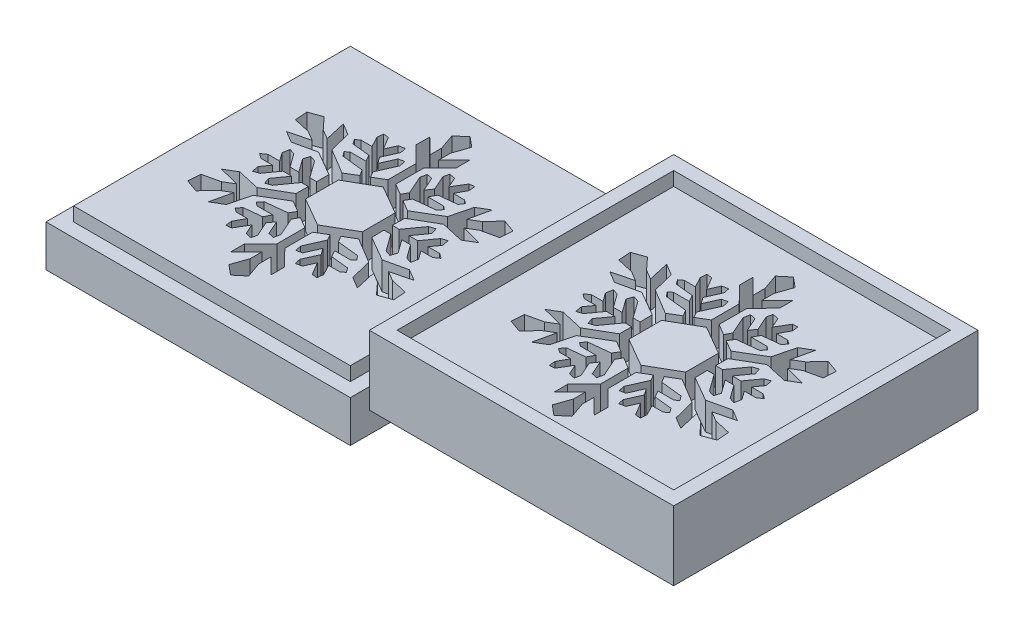
from build123d import *

# Parameters (mm, degrees)
CROQUIS1_W                                   = 110
CROQUIS1_H                                   = 110
SALIENTE_EXTRUIR1_DEPTH                      = 20
CORTAR_EXTRUIR1_DEPTH                        = 10
MATRIZ_START                                 = 12.5
MATRIZ_PARA_COPO_DE_NIEVE_INST_OUTLINE_W     = 110
MATRIZ_PARA_COPO_DE_NIEVE_INST_OUTLINE_H     = 110
MATRIZ_PARA_COPO_DE_NIEVE_INST_DEPTH         = 20
MATRIZ_PARA_COPO_DE_NIEVE_INST_2_DEPTH       = 10
MATRIZ_START_2                               = 32.5
MATRIZ_PARA_COPO_DE_NIEVE_INST_3_OUTLINE_W   = 110
MATRIZ_PARA_COPO_DE_NIEVE_INST_3_OUTLINE_H   = 110
MATRIZ_PARA_COPO_DE_NIEVE_INST_3_OUTLINE_W_2 = 100
MATRIZ_PARA_COPO_DE_NIEVE_INST_3_OUTLINE_H_2 = 100
MATRIZ_PARA_COPO_DE_NIEVE_INST_3_DEPTH       = 5
CROQUIS2_W                                   = 110
CROQUIS2_H                                   = 110
CROQUIS2_W_2                                 = 100
CROQUIS2_H_2                                 = 100
CORTAR_EXTRUIR2_DEPTH                        = 5


# Read off the part's stored shape, not the designer's step: matriz para copo de nieve inst
with BuildPart() as part:
    # Croquis1 → Saliente-Extruir1 (new body)
    with BuildSketch(Plane(origin=(0, 0, 0), x_dir=(1, 0, 0), z_dir=(0, 1, 0))):
        Rectangle(CROQUIS1_W, CROQUIS1_H)
    extrude(amount=SALIENTE_EXTRUIR1_DEPTH)

    # Croquis3 → Cortar-Extruir1 (cut)
    with BuildSketch(Plane(origin=(0, 20, 0), x_dir=(1, 0, 0), z_dir=(0, 1, 0))):
        Polygon((1.401750865, -15.024505482), (1.401750865, -25.082026445), (7.24046247, -31.053498659), (7.24046247, -35.944123141), (1.601246458, -30.344502802), (1.601246458, -34.62741655), (3.576654108, -40.299383405), (0, -43.308998471), (-3.576654108, -40.299383405), (-1.601246458, -34.62741655), (-1.601246458, -30.344502802), (-7.24046247, -35.944123141), (-7.24046247, -31.053498659), (-1.401750865, -25.082026445), (-1.401750865, -15.024505482), (-5.366397426, -12.668526031), (-6.553491469, -14.828021821), (-3.591131353, -21.513153795), (-4.043357191, -23.757533882), (-6.088103363, -23.345532788), (-8.342582526, -18.257869523), (-9.950365645, -20.524956593), (-7.588789114, -25.854305545), (-8.008622187, -27.937921538), (-10.181938561, -27.500014507), (-11.840331452, -23.757533882), (-14.557396536, -28.329816013), (-16.453298086, -28.525494001), (-16.685581739, -26.274924382), (-14.675689124, -22.536524118), (-18.691859369, -22.536524118), (-20.099896599, -21.537965872), (-18.945472608, -19.910147), (-12.480590093, -19.217261965), (-11.178475974, -16.848528018), (-16.886571, -16.848528018), (-18.152803347, -15.857491773), (-16.886571, -14.239645438), (-9.100363099, -13.405145055), (-7.802403677, -11.220936547), (-11.840331452, -8.821409952), (-20.887971279, -14.239645438), (-22.856293838, -21.955271204), (-26.95258016, -24.408357792), (-25.240992324, -16.848528018), (-28.748223024, -18.948854976), (-32.6411281, -23.181814498), (-37.221263287, -21.537965872), (-36.924320104, -17.081609197), (-30.926257151, -15.712777024), (-27.462068783, -13.638226234), (-34.810379623, -11.763608874), (-30.680733119, -9.290544333), (-22.620463637, -11.115434525), (-13.708215403, -5.959407612), (-13.652264332, -1.511972751), (-16.150867319, -1.511972751), (-20.556839856, -7.642319112), (-22.639157972, -8.340866636), (-23.381693859, -6.127422488), (-19.896981445, -1.278891572), (-23.050573262, -1.278891572), (-26.535285676, -6.127422488), (-28.571013719, -6.810340614), (-29.01659951, -4.344064752), (-26.813613241, -1.278891572), (-31.025246179, -1.278891572), (-32.80465997, 0), (-31.025246179, 1.278891572), (-26.813613241, 1.278891572), (-29.01659951, 4.344064752), (-28.571013719, 6.810340614), (-26.535285676, 6.127422488), (-23.050573262, 1.278891572), (-19.896981445, 1.278891572), (-23.381693859, 6.127422488), (-22.639157972, 8.340866636), (-20.556839856, 7.642319112), (-16.150867319, 1.511972751), (-13.652264332, 1.511972751), (-13.708215403, 5.959407612), (-22.620463637, 11.115434525), (-30.680733119, 9.290544333), (-34.810379623, 11.763608874), (-27.462068783, 13.638226234), (-30.926257151, 15.712777024), (-36.924320104, 17.081609197), (-37.221263287, 21.537965872), (-32.6411281, 23.181814498), (-28.748223024, 18.948854976), (-25.240992324, 16.848528018), (-26.95258016, 24.408357792), (-22.856293838, 21.955271204), (-20.887971279, 14.239645438), (-11.840331452, 8.821409952), (-7.802403677, 11.220936547), (-9.100363099, 13.405145055), (-16.886571, 14.239645438), (-18.152803347, 15.857491773), (-16.886571, 16.848528018), (-11.178475974, 16.848528018), (-12.480590093, 19.217261965), (-18.945472608, 19.910147), (-20.099896599, 21.537965872), (-18.691859369, 22.536524118), (-14.675689124, 22.536524118), (-16.685581739, 26.274924382), (-16.453298086, 28.525494001), (-14.557396536, 28.329816013), (-11.840331452, 23.757533882), (-10.181938561, 27.500014507), (-8.008622187, 27.937921538), (-7.588789114, 25.854305545), (-9.950365645, 20.524956593), (-8.342582526, 18.257869523), (-6.088103363, 23.345532788), (-4.043357191, 23.757533882), (-3.591131353, 21.513153795), (-6.553491469, 14.828021821), (-5.366397426, 12.668526031), (-1.401750865, 15.024505482), (-1.401750865, 25.082026445), (-7.24046247, 31.053498659), (-7.24046247, 35.944123141), (-1.601246458, 30.344502802), (-1.601246458, 34.62741655), (-3.576654108, 40.299383405), (0, 43.308998471), (3.576654108, 40.299383405), (1.601246458, 34.62741655), (1.601246458, 30.344502802), (7.24046247, 35.944123141), (7.24046247, 31.053498659), (1.401750865, 25.082026445), (1.401750865, 15.024505482), (5.366397426, 12.668526031), (6.553491469, 14.828021821), (3.591131353, 21.513153795), (4.043357191, 23.757533882), (6.088103363, 23.345532788), (8.342582526, 18.257869523), (9.950365645, 20.524956593), (7.588789114, 25.854305545), (8.008622187, 27.937921538), (10.181938561, 27.500014507), (11.840331452, 23.757533882), (14.557396536, 28.329816013), (16.453298086, 28.525494001), (16.685581739, 26.274924382), (14.675689124, 22.536524118), (18.691859369, 22.536524118), (20.099896599, 21.537965872), (18.945472608, 19.910147), (12.480590093, 19.217261965), (11.178475974, 16.848528018), (16.886571, 16.848528018), (18.152803347, 15.857491773), (16.886571, 14.239645438), (9.100363099, 13.405145055), (7.802403677, 11.220936547), (11.840331452, 8.821409952), (20.887971279, 14.239645438), (22.856293838, 21.955271204), (26.95258016, 24.408357792), (25.240992324, 16.848528018), (28.748223024, 18.948854976), (32.6411281, 23.181814498), (37.221263287, 21.537965872), (36.924320104, 17.081609197), (30.926257151, 15.712777024), (27.462068783, 13.638226234), (34.810379623, 11.763608874), (30.680733119, 9.290544333), (22.620463637, 11.115434525), (13.708215403, 5.959407612), (13.652264332, 1.511972751), (16.150867319, 1.511972751), (20.556839856, 7.642319112), (22.639157972, 8.340866636), (23.381693859, 6.127422488), (19.896981445, 1.278891572), (23.050573262, 1.278891572), (26.535285676, 6.127422488), (28.571013719, 6.810340614), (29.01659951, 4.344064752), (26.813613241, 1.278891572), (31.025246179, 1.278891572), (32.80465997, 0), (31.025246179, -1.278891572), (26.813613241, -1.278891572), (29.01659951, -4.344064752), (28.571013719, -6.810340614), (26.535285676, -6.127422488), (23.050573262, -1.278891572), (19.896981445, -1.278891572), (23.381693859, -6.127422488), (22.639157972, -8.340866636), (20.556839856, -7.642319112), (16.150867319, -1.511972751), (13.652264332, -1.511972751), (13.708215403, -5.959407612), (22.620463637, -11.115434525), (30.680733119, -9.290544333), (34.810379623, -11.763608874), (27.462068783, -13.638226234), (30.926257151, -15.712777024), (36.924320104, -17.081609197), (37.221263287, -21.537965872), (32.6411281, -23.181814498), (28.748223024, -18.948854976), (25.240992324, -16.848528018), (26.95258016, -24.408357792), (22.856293838, -21.955271204), (20.887971279, -14.239645438), (11.840331452, -8.821409952), (7.802403677, -11.220936547), (9.100363099, -13.405145055), (16.886571, -14.239645438), (18.152803347, -15.857491773), (16.886571, -16.848528018), (11.178475974, -16.848528018), (12.480590093, -19.217261965), (18.945472608, -19.910147), (20.099896599, -21.537965872), (18.691859369, -22.536524118), (14.675689124, -22.536524118), (16.685581739, -26.274924382), (16.453298086, -28.525494001), (14.557396536, -28.329816013), (11.840331452, -23.757533882), (10.181938561, -27.500014507), (8.008622187, -27.937921538), (7.588789114, -25.854305545), (9.950365645, -20.524956593), (8.342582526, -18.257869523), (6.088103363, -23.345532788), (4.043357191, -23.757533882), (3.591131353, -21.513153795), (6.553491469, -14.828021821), (5.366397426, -12.668526031), align=None)
        Polygon((10.26956557, -5.929136446), (10.26956557, 5.929136446), (0, 11.858272893), (-10.26956557, 5.929136446), (-10.26956557, -5.929136446), (0, -11.858272893), align=None, mode=Mode.SUBTRACT)
    extrude(amount=-CORTAR_EXTRUIR1_DEPTH, mode=Mode.SUBTRACT)

    # Croquis2 → Cortar-Extruir2 (cut)
    with BuildSketch(Plane(origin=(0, 20, 0), x_dir=(1, 0, 0), z_dir=(0, 1, 0))):
        Rectangle(CROQUIS2_W, CROQUIS2_H)
        Rectangle(CROQUIS2_W_2, CROQUIS2_H_2, mode=Mode.SUBTRACT)
    extrude(amount=-CORTAR_EXTRUIR2_DEPTH, mode=Mode.SUBTRACT)


with BuildPart() as body_2:
    # matriz para copo de nieve inst outline → matriz para copo de nieve inst (new body)
    # profile 1 of 2: a face of its own
    with BuildSketch(Plane(origin=(0, 0, 0), x_dir=(1, 0, 0), z_dir=(0, 1, 0)).offset(MATRIZ_START)):
        with Locations((114.843651792, 2.026652679)):
            Rectangle(MATRIZ_PARA_COPO_DE_NIEVE_INST_OUTLINE_W, MATRIZ_PARA_COPO_DE_NIEVE_INST_OUTLINE_H)
        Polygon((122.084114261, -33.917470462), (116.44489825, -28.317850124), (116.44489825, -32.600763871), (118.4203059, -38.272730726), (114.843651792, -41.282345792), (111.266997684, -38.272730726), (113.242405333, -32.600763871), (113.242405333, -28.317850124), (107.603189322, -33.917470462), (107.603189322, -29.02684598), (113.441900926, -23.055373767), (113.441900926, -12.997852803), (109.477254366, -10.641873352), (108.290160323, -12.801369143), (111.252520439, -19.486501117), (110.8002946, -21.730881203), (108.755548429, -21.318880109), (106.501069266, -16.231216844), (104.893286146, -18.498303914), (107.254862678, -23.827652867), (106.835029605, -25.911268859), (104.661713231, -25.473361829), (103.00332034, -21.730881203), (100.286255255, -26.303163334), (98.390353705, -26.498841323), (98.158070053, -24.248271703), (100.167962668, -20.50987144), (96.151792423, -20.50987144), (94.743755193, -19.511313193), (95.898179184, -17.883494322), (102.363061699, -17.190609286), (103.665175818, -14.82187534), (97.957080791, -14.82187534), (96.690848444, -13.830839094), (97.957080791, -12.212992759), (105.743288692, -11.378492376), (107.041248115, -9.194283868), (103.00332034, -6.794757274), (93.955680513, -12.212992759), (91.987357953, -19.928618525), (87.891071631, -22.381705113), (89.602659468, -14.82187534), (86.095428768, -16.922202298), (82.202523691, -21.155161819), (77.622388505, -19.511313193), (77.919331687, -15.054956519), (83.917394641, -13.686124345), (87.381583009, -11.611573555), (80.033272168, -9.736956195), (84.162918672, -7.263891655), (92.223188154, -9.088781847), (101.135436388, -3.932754934), (101.19138746, 0.514679928), (98.692784473, 0.514679928), (94.286811935, -5.615666433), (92.20449382, -6.314213957), (91.461957933, -4.10076981), (94.946670347, 0.747761107), (91.793078529, 0.747761107), (88.308366115, -4.10076981), (86.272638073, -4.783687935), (85.827052282, -2.317412074), (88.030038551, 0.747761107), (83.818405612, 0.747761107), (82.038991822, 2.026652679), (83.818405612, 3.30554425), (88.030038551, 3.30554425), (85.827052282, 6.370717431), (86.272638073, 8.836993292), (88.308366115, 8.154075167), (91.793078529, 3.30554425), (94.946670347, 3.30554425), (91.461957933, 8.154075167), (92.20449382, 10.367519315), (94.286811935, 9.668971791), (98.692784473, 3.538625429), (101.19138746, 3.538625429), (101.135436388, 7.986060291), (92.223188154, 13.142087204), (84.162918672, 11.317197012), (80.033272168, 13.790261553), (87.381583009, 15.664878913), (83.917394641, 17.739429702), (77.919331687, 19.108261876), (77.622388505, 23.56461855), (82.202523691, 25.208467177), (86.095428768, 20.975507655), (89.602659468, 18.875180697), (87.891071631, 26.435010471), (91.987357953, 23.981923883), (93.955680513, 16.266298117), (103.00332034, 10.848062631), (107.041248115, 13.247589226), (105.743288692, 15.431797734), (97.957080791, 16.266298117), (96.690848444, 17.884144451), (97.957080791, 18.875180697), (103.665175818, 18.875180697), (102.363061699, 21.243914644), (95.898179184, 21.936799679), (94.743755193, 23.56461855), (96.151792423, 24.563176797), (100.167962668, 24.563176797), (98.158070053, 28.301577061), (98.390353705, 30.55214668), (100.286255255, 30.356468691), (103.00332034, 25.784186561), (104.661713231, 29.526667186), (106.835029605, 29.964574217), (107.254862678, 27.880958224), (104.893286146, 22.551609272), (106.501069266, 20.284522202), (108.755548429, 25.372185466), (110.8002946, 25.784186561), (111.252520439, 23.539806474), (108.290160323, 16.8546745), (109.477254366, 14.69517871), (113.441900926, 17.05115816), (113.441900926, 27.108679124), (107.603189322, 33.080151338), (107.603189322, 37.97077582), (113.242405333, 32.371155481), (113.242405333, 36.654069229), (111.266997684, 42.326036083), (114.843651792, 45.335651149), (118.4203059, 42.326036083), (116.44489825, 36.654069229), (116.44489825, 32.371155481), (122.084114261, 37.97077582), (122.084114261, 33.080151338), (116.245402657, 27.108679124), (116.245402657, 17.05115816), (120.210049217, 14.69517871), (121.39714326, 16.8546745), (118.434783144, 23.539806474), (118.887008983, 25.784186561), (120.931755154, 25.372185466), (123.186234317, 20.284522202), (124.794017437, 22.551609272), (122.432440905, 27.880958224), (122.852273979, 29.964574217), (125.025590352, 29.526667186), (126.683983243, 25.784186561), (129.401048328, 30.356468691), (131.296949878, 30.55214668), (131.52923353, 28.301577061), (129.519340915, 24.563176797), (133.53551116, 24.563176797), (134.94354839, 23.56461855), (133.7891244, 21.936799679), (127.324241884, 21.243914644), (126.022127765, 18.875180697), (131.730222792, 18.875180697), (132.996455139, 17.884144451), (131.730222792, 16.266298117), (123.944014891, 15.431797734), (122.646055468, 13.247589226), (126.683983243, 10.848062631), (135.73162307, 16.266298117), (137.69994563, 23.981923883), (141.796231952, 26.435010471), (140.084644115, 18.875180697), (143.591874815, 20.975507655), (147.484779892, 25.208467177), (152.064915078, 23.56461855), (151.767971896, 19.108261876), (145.769908943, 17.739429702), (142.305720574, 15.664878913), (149.654031415, 13.790261553), (145.524384911, 11.317197012), (137.464115429, 13.142087204), (128.551867195, 7.986060291), (128.495916123, 3.538625429), (130.99451911, 3.538625429), (135.400491648, 9.668971791), (137.482809764, 10.367519315), (138.22534565, 8.154075167), (134.740633236, 3.30554425), (137.894225054, 3.30554425), (141.378937468, 8.154075167), (143.41466551, 8.836993292), (143.860251301, 6.370717431), (141.657265032, 3.30554425), (145.868897971, 3.30554425), (147.648311761, 2.026652679), (145.868897971, 0.747761107), (141.657265032, 0.747761107), (143.860251301, -2.317412074), (143.41466551, -4.783687935), (141.378937468, -4.10076981), (137.894225054, 0.747761107), (134.740633236, 0.747761107), (138.22534565, -4.10076981), (137.482809764, -6.314213957), (135.400491648, -5.615666433), (130.99451911, 0.514679928), (128.495916123, 0.514679928), (128.551867195, -3.932754934), (137.464115429, -9.088781847), (145.524384911, -7.263891655), (149.654031415, -9.736956195), (142.305720574, -11.611573555), (145.769908943, -13.686124345), (151.767971896, -15.054956519), (152.064915078, -19.511313193), (147.484779892, -21.155161819), (143.591874815, -16.922202298), (140.084644115, -14.82187534), (141.796231952, -22.381705113), (137.69994563, -19.928618525), (135.73162307, -12.212992759), (126.683983243, -6.794757274), (122.646055468, -9.194283868), (123.944014891, -11.378492376), (131.730222792, -12.212992759), (132.996455139, -13.830839094), (131.730222792, -14.82187534), (126.022127765, -14.82187534), (127.324241884, -17.190609286), (133.7891244, -17.883494322), (134.94354839, -19.511313193), (133.53551116, -20.50987144), (129.519340915, -20.50987144), (131.52923353, -24.248271703), (131.296949878, -26.498841323), (129.401048328, -26.303163334), (126.683983243, -21.730881203), (125.025590352, -25.473361829), (122.852273979, -25.911268859), (122.432440905, -23.827652867), (124.794017437, -18.498303914), (123.186234317, -16.231216844), (120.931755154, -21.318880109), (118.887008983, -21.730881203), (118.434783144, -19.486501117), (121.39714326, -12.801369143), (120.210049217, -10.641873352), (116.245402657, -12.997852803), (116.245402657, -23.055373767), (122.084114261, -29.02684598), align=None, mode=Mode.SUBTRACT)
    # profile 2 of 2: a face of its own
    with BuildSketch(Plane(origin=(0, 0, 0), x_dir=(1, 0, 0), z_dir=(0, 1, 0)).offset(MATRIZ_START)):
        Polygon((104.574086222, -3.902483768), (114.843651792, -9.831620214), (125.113217362, -3.902483768), (125.113217362, 7.955789125), (114.843651792, 13.884925571), (104.574086222, 7.955789125), align=None)
    extrude(amount=MATRIZ_PARA_COPO_DE_NIEVE_INST_DEPTH)

    # matriz para copo de nieve inst 2 outline → matriz para copo de nieve inst 2 (add)
    with BuildSketch(Plane(origin=(0, 0, 0), x_dir=(1, 0, 0), z_dir=(0, 1, 0)).offset(MATRIZ_START)):
        Polygon((116.245402657, -23.055373767), (116.245402657, -12.997852803), (120.210049217, -10.641873352), (121.39714326, -12.801369143), (118.434783144, -19.486501117), (118.887008983, -21.730881203), (120.931755154, -21.318880109), (123.186234317, -16.231216844), (124.794017437, -18.498303914), (122.432440905, -23.827652867), (122.852273979, -25.911268859), (125.025590352, -25.473361829), (126.683983243, -21.730881203), (129.401048328, -26.303163334), (131.296949878, -26.498841323), (131.52923353, -24.248271703), (129.519340915, -20.50987144), (133.53551116, -20.50987144), (134.94354839, -19.511313193), (133.7891244, -17.883494322), (127.324241884, -17.190609286), (126.022127765, -14.82187534), (131.730222792, -14.82187534), (132.996455139, -13.830839094), (131.730222792, -12.212992759), (123.944014891, -11.378492376), (122.646055468, -9.194283868), (126.683983243, -6.794757274), (135.73162307, -12.212992759), (137.69994563, -19.928618525), (141.796231952, -22.381705113), (140.084644115, -14.82187534), (143.591874815, -16.922202298), (147.484779892, -21.155161819), (152.064915078, -19.511313193), (151.767971896, -15.054956519), (145.769908943, -13.686124345), (142.305720574, -11.611573555), (149.654031415, -9.736956195), (145.524384911, -7.263891655), (137.464115429, -9.088781847), (128.551867195, -3.932754934), (128.495916123, 0.514679928), (130.99451911, 0.514679928), (135.400491648, -5.615666433), (137.482809764, -6.314213957), (138.22534565, -4.10076981), (134.740633236, 0.747761107), (137.894225054, 0.747761107), (141.378937468, -4.10076981), (143.41466551, -4.783687935), (143.860251301, -2.317412074), (141.657265032, 0.747761107), (145.868897971, 0.747761107), (147.648311761, 2.026652679), (145.868897971, 3.30554425), (141.657265032, 3.30554425), (143.860251301, 6.370717431), (143.41466551, 8.836993292), (141.378937468, 8.154075167), (137.894225054, 3.30554425), (134.740633236, 3.30554425), (138.22534565, 8.154075167), (137.482809764, 10.367519315), (135.400491648, 9.668971791), (130.99451911, 3.538625429), (128.495916123, 3.538625429), (128.551867195, 7.986060291), (137.464115429, 13.142087204), (145.524384911, 11.317197012), (149.654031415, 13.790261553), (142.305720574, 15.664878913), (145.769908943, 17.739429702), (151.767971896, 19.108261876), (152.064915078, 23.56461855), (147.484779892, 25.208467177), (143.591874815, 20.975507655), (140.084644115, 18.875180697), (141.796231952, 26.435010471), (137.69994563, 23.981923883), (135.73162307, 16.266298117), (126.683983243, 10.848062631), (122.646055468, 13.247589226), (123.944014891, 15.431797734), (131.730222792, 16.266298117), (132.996455139, 17.884144451), (131.730222792, 18.875180697), (126.022127765, 18.875180697), (127.324241884, 21.243914644), (133.7891244, 21.936799679), (134.94354839, 23.56461855), (133.53551116, 24.563176797), (129.519340915, 24.563176797), (131.52923353, 28.301577061), (131.296949878, 30.55214668), (129.401048328, 30.356468691), (126.683983243, 25.784186561), (125.025590352, 29.526667186), (122.852273979, 29.964574217), (122.432440905, 27.880958224), (124.794017437, 22.551609272), (123.186234317, 20.284522202), (120.931755154, 25.372185466), (118.887008983, 25.784186561), (118.434783144, 23.539806474), (121.39714326, 16.8546745), (120.210049217, 14.69517871), (116.245402657, 17.05115816), (116.245402657, 27.108679124), (122.084114261, 33.080151338), (122.084114261, 37.97077582), (116.44489825, 32.371155481), (116.44489825, 36.654069229), (118.4203059, 42.326036083), (114.843651792, 45.335651149), (111.266997684, 42.326036083), (113.242405333, 36.654069229), (113.242405333, 32.371155481), (107.603189322, 37.97077582), (107.603189322, 33.080151338), (113.441900926, 27.108679124), (113.441900926, 17.05115816), (109.477254366, 14.69517871), (108.290160323, 16.8546745), (111.252520439, 23.539806474), (110.8002946, 25.784186561), (108.755548429, 25.372185466), (106.501069266, 20.284522202), (104.893286146, 22.551609272), (107.254862678, 27.880958224), (106.835029605, 29.964574217), (104.661713231, 29.526667186), (103.00332034, 25.784186561), (100.286255255, 30.356468691), (98.390353705, 30.55214668), (98.158070053, 28.301577061), (100.167962668, 24.563176797), (96.151792423, 24.563176797), (94.743755193, 23.56461855), (95.898179184, 21.936799679), (102.363061699, 21.243914644), (103.665175818, 18.875180697), (97.957080791, 18.875180697), (96.690848444, 17.884144451), (97.957080791, 16.266298117), (105.743288692, 15.431797734), (107.041248115, 13.247589226), (103.00332034, 10.848062631), (93.955680513, 16.266298117), (91.987357953, 23.981923883), (87.891071631, 26.435010471), (89.602659468, 18.875180697), (86.095428768, 20.975507655), (82.202523691, 25.208467177), (77.622388505, 23.56461855), (77.919331687, 19.108261876), (83.917394641, 17.739429702), (87.381583009, 15.664878913), (80.033272168, 13.790261553), (84.162918672, 11.317197012), (92.223188154, 13.142087204), (101.135436388, 7.986060291), (101.19138746, 3.538625429), (98.692784473, 3.538625429), (94.286811935, 9.668971791), (92.20449382, 10.367519315), (91.461957933, 8.154075167), (94.946670347, 3.30554425), (91.793078529, 3.30554425), (88.308366115, 8.154075167), (86.272638073, 8.836993292), (85.827052282, 6.370717431), (88.030038551, 3.30554425), (83.818405612, 3.30554425), (82.038991822, 2.026652679), (83.818405612, 0.747761107), (88.030038551, 0.747761107), (85.827052282, -2.317412074), (86.272638073, -4.783687935), (88.308366115, -4.10076981), (91.793078529, 0.747761107), (94.946670347, 0.747761107), (91.461957933, -4.10076981), (92.20449382, -6.314213957), (94.286811935, -5.615666433), (98.692784473, 0.514679928), (101.19138746, 0.514679928), (101.135436388, -3.932754934), (92.223188154, -9.088781847), (84.162918672, -7.263891655), (80.033272168, -9.736956195), (87.381583009, -11.611573555), (83.917394641, -13.686124345), (77.919331687, -15.054956519), (77.622388505, -19.511313193), (82.202523691, -21.155161819), (86.095428768, -16.922202298), (89.602659468, -14.82187534), (87.891071631, -22.381705113), (91.987357953, -19.928618525), (93.955680513, -12.212992759), (103.00332034, -6.794757274), (107.041248115, -9.194283868), (105.743288692, -11.378492376), (97.957080791, -12.212992759), (96.690848444, -13.830839094), (97.957080791, -14.82187534), (103.665175818, -14.82187534), (102.363061699, -17.190609286), (95.898179184, -17.883494322), (94.743755193, -19.511313193), (96.151792423, -20.50987144), (100.167962668, -20.50987144), (98.158070053, -24.248271703), (98.390353705, -26.498841323), (100.286255255, -26.303163334), (103.00332034, -21.730881203), (104.661713231, -25.473361829), (106.835029605, -25.911268859), (107.254862678, -23.827652867), (104.893286146, -18.498303914), (106.501069266, -16.231216844), (108.755548429, -21.318880109), (110.8002946, -21.730881203), (111.252520439, -19.486501117), (108.290160323, -12.801369143), (109.477254366, -10.641873352), (113.441900926, -12.997852803), (113.441900926, -23.055373767), (107.603189322, -29.02684598), (107.603189322, -33.917470462), (113.242405333, -28.317850124), (113.242405333, -32.600763871), (111.266997684, -38.272730726), (114.843651792, -41.282345792), (118.4203059, -38.272730726), (116.44489825, -32.600763871), (116.44489825, -28.317850124), (122.084114261, -33.917470462), (122.084114261, -29.02684598), align=None)
        Polygon((125.113217362, -3.902483768), (114.843651792, -9.831620214), (104.574086222, -3.902483768), (104.574086222, 7.955789125), (114.843651792, 13.884925571), (125.113217362, 7.955789125), align=None, mode=Mode.SUBTRACT)
    extrude(amount=MATRIZ_PARA_COPO_DE_NIEVE_INST_2_DEPTH)

    # matriz para copo de nieve inst 3 outline → matriz para copo de nieve inst 3 (add)
    with BuildSketch(Plane(origin=(0, 0, 0), x_dir=(1, 0, 0), z_dir=(0, 1, 0)).offset(MATRIZ_START_2)):
        with Locations((114.843651792, 2.026652679)):
            Rectangle(MATRIZ_PARA_COPO_DE_NIEVE_INST_3_OUTLINE_W, MATRIZ_PARA_COPO_DE_NIEVE_INST_3_OUTLINE_H)
        with Locations((114.843651792, 2.026652679)):
            Rectangle(MATRIZ_PARA_COPO_DE_NIEVE_INST_3_OUTLINE_W_2, MATRIZ_PARA_COPO_DE_NIEVE_INST_3_OUTLINE_H_2, mode=Mode.SUBTRACT)
    extrude(amount=MATRIZ_PARA_COPO_DE_NIEVE_INST_3_DEPTH)


solid = Compound([part.part, body_2.part])
